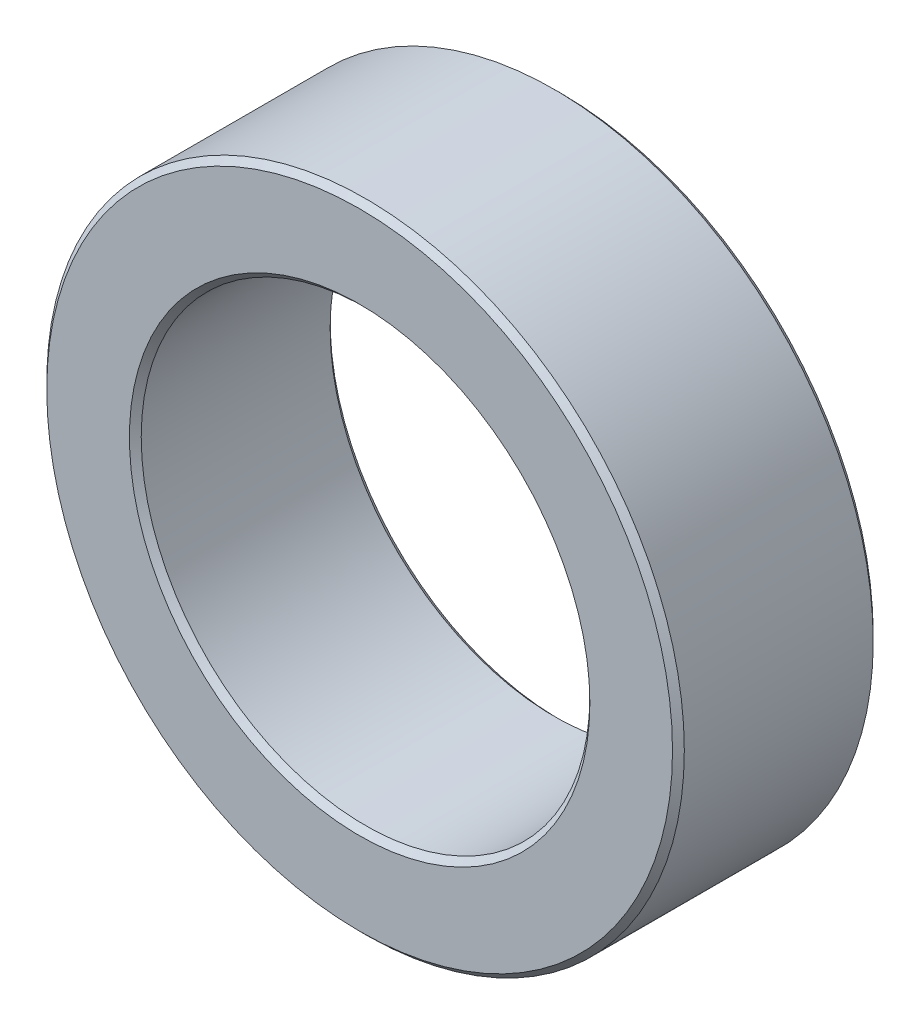
from build123d import *

# Parameters (mm, degrees)
SKIZZE1_R                       = 27
SKIZZE1_R_2                     = 19
AUFSATZ_LINEAR_AUSTRAGEN1_DEPTH = 8.5
FASE1_SIZE                      = 0.5


with BuildPart() as part:
    # Skizze1 → Aufsatz-Linear austragen1 (new, symmetric)
    with BuildSketch(Plane.XY):
        Circle(SKIZZE1_R)
        Circle(SKIZZE1_R_2, mode=Mode.SUBTRACT)
    extrude(amount=AUFSATZ_LINEAR_AUSTRAGEN1_DEPTH, both=True)

    # Fase1
    fase1_edges = [part.edges().sort_by_distance(p)[0] for p in [
        (-19, 0, -8.5),
        (-27, 0, -8.5),
        (-27, 0, 8.5),
        (-19, 0, 8.5),
    ]]
    chamfer(fase1_edges, length=FASE1_SIZE)


solid = part.part
